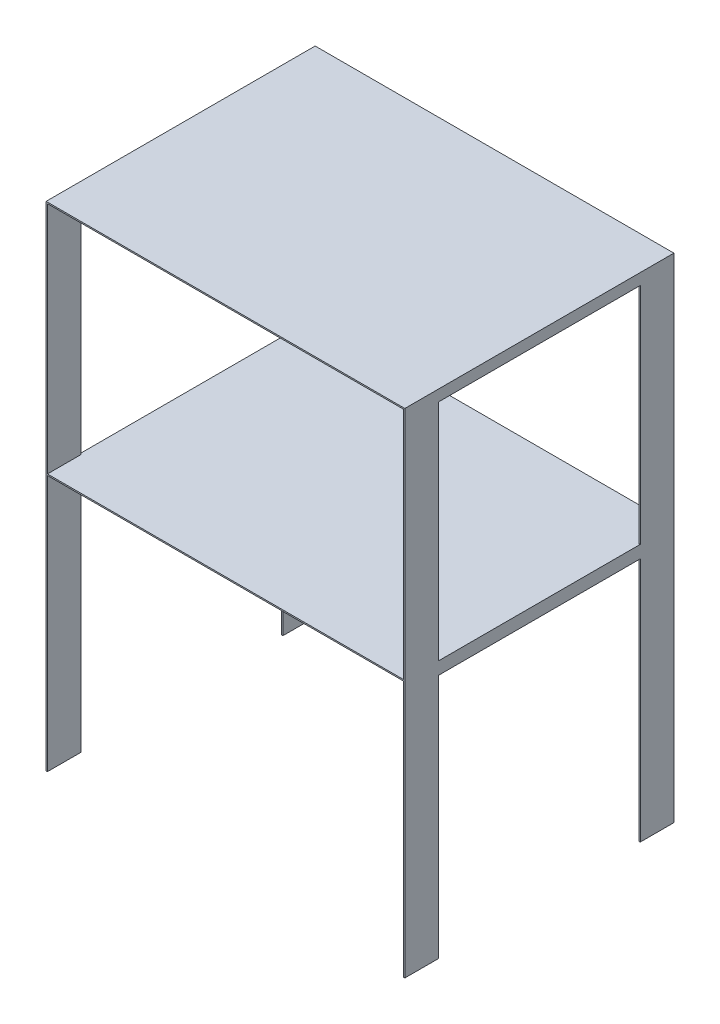
from build123d import *

# Parameters (mm, degrees)
ESBO_O1_W                = 320
ESBO_O1_H                = 240
RESSALTO_EXTRUS_O1_DEPTH = 440
CORTE_EXTRUS_O1_DEPTH    = 220
SKETCH4_W                = 320
SKETCH4_H                = 240
BOSS_EXTRUDE2_DEPTH      = 1.2
CUT_EXTRUDE1_DEPTH       = 10
CUT_EXTRUDE2_DEPTH       = 200
SKETCH7_W                = 317.6
SKETCH7_H                = 240
CUT_EXTRUDE3_DEPTH       = 8.8
SKETCH9_W                = 338.812461563
SKETCH9_H                = 258.873896412
CUT_EXTRUDE4_DEPTH       = 1.2


# Read off the part's stored shape, not the designer's step: Corte-extrusão1
with BuildPart() as part:
    # Esboço1 → Ressalto-extrusão1 (new body)
    with BuildSketch(Plane(origin=(0, 0, 0), x_dir=(1, 0, 0), z_dir=(0, 1, 0))):
        Rectangle(ESBO_O1_W, ESBO_O1_H)
    extrude(amount=RESSALTO_EXTRUS_O1_DEPTH)

    # Corte-extrusão1 outline → Corte-extrusão1 (cut)
    with BuildSketch(Plane(origin=(0, 0, 0), x_dir=(1, 0, 0), z_dir=(0, 1, 0))):
        Polygon((158.8, -120), (158.8, -90), (160, -90), (160, 90), (158.8, 90), (158.8, 120), (-158.8, 120), (-158.8, 90), (-160, 90), (-160, -90), (-158.8, -90), (-158.8, -120), align=None)
    extrude(amount=CORTE_EXTRUS_O1_DEPTH, mode=Mode.SUBTRACT)

    # Sketch4 → Boss-Extrude2 (add)
    with BuildSketch(Plane(origin=(0, 440, 0), x_dir=(1, 0, 0), z_dir=(0, 1, 0))):
        Rectangle(SKETCH4_W, SKETCH4_H)
    extrude(amount=BOSS_EXTRUDE2_DEPTH)

    # Esboço5 → Cut-Extrude1 (cut)
    with BuildSketch(Plane.XZ.offset(-220)):
        Polygon((158.8, -90), (158.8, -120), (-158.8, -120), (-158.8, 120), (158.8, 120), align=None)
    extrude(amount=-CUT_EXTRUDE1_DEPTH, mode=Mode.SUBTRACT)

    # Sketch6 → Cut-Extrude2 (cut)
    with BuildSketch(Plane(origin=(0, 231.2, 0), x_dir=(-1, 0, 0), z_dir=(0, -1, 0))):
        Polygon((158.8, -120), (158.8, -90), (160, -90), (160, 90), (158.8, 90), (158.8, 120), (-158.8, 120), (-158.8, 90), (-160, 90), (-160, -90), (-158.8, -90), (-158.8, -120), align=None)
    extrude(amount=-CUT_EXTRUDE2_DEPTH, mode=Mode.SUBTRACT)

    # Sketch7 → Cut-Extrude3 (cut)
    with BuildSketch(Plane(origin=(0, 431.2, 0), x_dir=(-1, 0, 0), z_dir=(0, -1, 0))):
        Rectangle(SKETCH7_W, SKETCH7_H)
    extrude(amount=-CUT_EXTRUDE3_DEPTH, mode=Mode.SUBTRACT)

    # Sketch9 → Cut-Extrude4 (cut)
    with BuildSketch(Plane(origin=(0, 0, 0), x_dir=(-1, 0, 0), z_dir=(0, -1, 0))):
        with Locations((2.117577884, -1.826723931)):
            Rectangle(SKETCH9_W, SKETCH9_H)
    extrude(amount=-CUT_EXTRUDE4_DEPTH, mode=Mode.SUBTRACT)


solid = part.part
